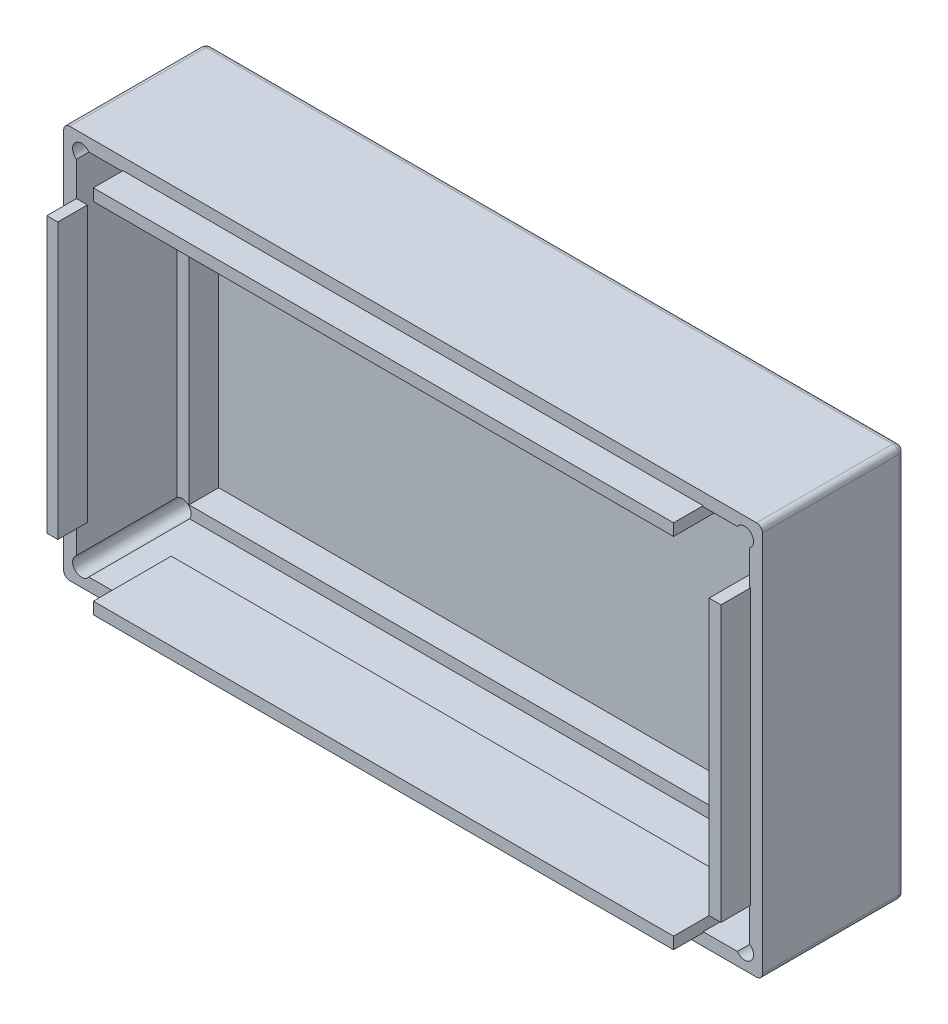
from build123d import *
from build123d.topology import SkipClean

# Parameters (mm, degrees)
BOSS_EXTRUDE1_DEPTH                        = 2
SKETCH2_W                                  = 113.60000000000001
SKETCH2_H                                  = 62.1
SKETCH2_W_2                                = 109.60000000000001
SKETCH2_H_2                                = 58.1
BOSS_EXTRUDE2_DEPTH                        = 5
SKETCH3_R                                  = 1.5000000000000042
CUT_EXTRUDE2_DEPTH                         = 71.85433681838424
MIRROR3_AT_THE_SECOND_PLANE_COPY_1_SKETC_R = 1.5000000000000042
MIRROR3_AT_THE_SECOND_PLANE_COPY_1_DEPTH   = 71.85433681838424
FILLET1_R                                  = 1
FILLET2_R                                  = 1
BOSS_EXTRUDE3_DEPTH                        = 22
SKETCH7_W                                  = 97.9
SKETCH7_H                                  = 1.999999999999993
BOSS_EXTRUDE4_DEPTH                        = 5
CHAMFER1_SIZE                              = 10
CHAMFER2_SIZE                              = 10
CUT_EXTRUDE3_DEPTH                         = 5
FILLET3_R                                  = 1


# Some blends are built 0.0001 mm under size
with BuildPart() as part:
    # Sketch1 → Boss-Extrude1 (new body)
    with BuildSketch(Plane.XY):
        Polygon((-55.697933748362985, 33.2), (62.20206625163701, 33.2), (62.202066251637014, -33.2), (-55.697933748362985, -33.2), align=None)
    extrude(amount=BOSS_EXTRUDE1_DEPTH)

    # Sketch2 → Boss-Extrude2 (add)
    with BuildSketch(Plane.XY.offset(2)):
        with Locations((3.252066251637011, 0)):
            Rectangle(SKETCH2_W, SKETCH2_H)
        with Locations((3.252066251637011, 0)):
            Rectangle(SKETCH2_W_2, SKETCH2_H_2, mode=Mode.SUBTRACT)
    extrude(amount=BOSS_EXTRUDE2_DEPTH)

    # Sketch3 → Cut-Extrude2 (cut, symmetric)
    with BuildSketch(Plane(origin=(0, 0, 0), x_dir=(-1, 0, 0), z_dir=(0, 0, -1))):
        with Locations(Location((-59.202066251637, 30.200000000000003, 0), (0, 0, 34.518107841))):
            Circle(SKETCH3_R)
    cut_extrude2 = extrude(amount=CUT_EXTRUDE2_DEPTH, both=True, mode=Mode.SUBTRACT)

    # Mirror2: Cut-Extrude2 across plane
    add(cut_extrude2.mirror(Plane.ZX), mode=Mode.SUBTRACT)

    # Mirror3: Cut-Extrude2 across plane
    add(cut_extrude2.mirror(Plane.ZX), mode=Mode.SUBTRACT)

    # Mirror3 at the second plane: Cut-Extrude2 across plane
    add(cut_extrude2.mirror(Plane(origin=(3.2520662516370114, 0, 0), x_dir=(0, 0, 1), z_dir=(1, 0, 0))), mode=Mode.SUBTRACT)

    # Mirror3 at the second plane copy 1 sketc → Mirror3 at the second plane copy 1 (cut, symmetric)
    with BuildSketch(Plane(origin=(6.504132503274023, 0, 0), x_dir=(1, 0, 0), z_dir=(0, 0, -1))):
        with Locations(Location((-59.202066251637, 30.200000000000003, 0), (0, 0, 34.518107841))):
            Circle(MIRROR3_AT_THE_SECOND_PLANE_COPY_1_SKETC_R)
    extrude(amount=MIRROR3_AT_THE_SECOND_PLANE_COPY_1_DEPTH, both=True, mode=Mode.SUBTRACT)

    # Fillet1
    fillet1_edges = [part.edges().sort_by_distance(p)[0] for p in [
        (62.202066251637014, -33.2, 1),
        (-55.697933748362985, -33.2, 1),
        (-55.697933748362985, 33.2, 1),
        (62.20206625163701, 33.2, 1),
    ]]
    fillet(fillet1_edges, radius=FILLET1_R)

    # Fillet2
    # the kernel refuses this fillet: 1 mm, written as the material it takes off along each edge
    with BuildSketch(Plane(origin=(62.20206625163701, 32.2, 0), x_dir=(-1, -1.1e-16, 0), z_dir=(1.1e-16, -1, 0)), Plane(origin=(-55.697933748362985, -32.2, 0), x_dir=(1, 0, 0), z_dir=(0, 1, 0))) as fillet2_piece_1:
        with BuildLine():
            CenterArc((FILLET2_R, -FILLET2_R), FILLET2_R, 90, 90)
            Line((0, -FILLET2_R), (0, 0))
            Line((0, 0), (FILLET2_R, 0))
        make_face()
    extrude(amount=64.4, mode=Mode.SUBTRACT)
    with BuildSketch(Plane(origin=(61.202066251637014, -33.2, 0), x_dir=(0, 1, 0), z_dir=(-1, 0, 0))) as fillet2_piece_2:
        with BuildLine():
            CenterArc((FILLET2_R, -FILLET2_R), FILLET2_R, 90, 90)
            Line((0, -FILLET2_R), (0, 0))
            Line((0, 0), (FILLET2_R, 0))
        make_face()
    extrude(amount=115.9, mode=Mode.SUBTRACT)
    with BuildSketch(Plane(origin=(-54.697933748362985, 33.2, 0), x_dir=(0, 0, 1), z_dir=(1, 0, 0))) as fillet2_piece_3:
        with BuildLine():
            CenterArc((FILLET2_R, FILLET2_R), FILLET2_R, 180, 90)
            Line((-1.1e-16, FILLET2_R), (0, 0))
            Line((0, 0), (FILLET2_R, 0))
        make_face()
    extrude(amount=115.89999999999999, mode=Mode.SUBTRACT)
    with BuildSketch(Plane(origin=(-54.697933748362985, -32.2, 0), x_dir=(-1, 0, 0), z_dir=(0, 1, 0))) as fillet2_piece_4:
        with BuildLine():
            CenterArc((1 - FILLET2_R, FILLET2_R), FILLET2_R, 270, 90)
            Line((1, FILLET2_R), (1, 0))
            Line((1, 0), (1 - FILLET2_R, 0))
        make_face()
    revolve(axis=Axis((-54.697933748362985, -32.2, 0), (0, 0, 1)), revolution_arc=90, mode=Mode.SUBTRACT)
    with BuildSketch(Plane(origin=(-54.697933748362985, 32.2, 0), x_dir=(0, 1, 0), z_dir=(1, 0, 0))) as fillet2_piece_5:
        with BuildLine():
            CenterArc((1 - FILLET2_R, FILLET2_R), FILLET2_R, 270, 90)
            Line((1, FILLET2_R), (1, 0))
            Line((1, 0), (1 - FILLET2_R, 0))
        make_face()
    revolve(axis=Axis((-54.697933748362985, 32.2, 0), (0, 0, 1)), revolution_arc=90, mode=Mode.SUBTRACT)
    with BuildSketch(Plane(origin=(61.20206625163701, 32.2, 0), x_dir=(0, 1, 0), z_dir=(-1, 0, 0))) as fillet2_piece_6:
        with BuildLine():
            CenterArc((1 - FILLET2_R, -FILLET2_R), FILLET2_R, 6.36e-15, 90)
            Line((1, -FILLET2_R), (1, 0))
            Line((1, 0), (1 - FILLET2_R, 0))
        make_face()
    revolve(axis=Axis((61.20206625163701, 32.2, 0), (0, 0, -1)), revolution_arc=90, mode=Mode.SUBTRACT)
    with BuildSketch(Plane(origin=(61.202066251637014, -32.2, 0), x_dir=(1, 0, 0), z_dir=(0, 1, 0))) as fillet2_piece_7:
        with BuildLine():
            CenterArc((1 - FILLET2_R, -FILLET2_R), FILLET2_R, 6.36e-15, 90)
            Line((1, -FILLET2_R), (1, 0))
            Line((1, 0), (1 - FILLET2_R, 0))
        make_face()
    revolve(axis=Axis((61.202066251637014, -32.2, 0), (0, 0, -1)), revolution_arc=90, mode=Mode.SUBTRACT)
    with BuildSketch(Plane(origin=(59.202066251637, 30.200000000000003, 0), x_dir=(-0.8239471396211576, 0.5666666666657856, 0), z_dir=(-0.5666666666657856, -0.8239471396211576, 0))) as fillet2_piece_8:
        with BuildLine():
            CenterArc((1.5000000000000024 + FILLET2_R, -FILLET2_R), FILLET2_R, 90, 90)
            Line((1.5000000000000024, -FILLET2_R), (1.5000000000000024, 0))
            Line((1.5000000000000024, 0), (1.5000000000000024 + FILLET2_R, 0))
        make_face()
    revolve(axis=Axis((59.202066251637, 30.200000000000003, 0), (0, 0, -1)), mode=Mode.SUBTRACT)
    with BuildSketch(Plane(origin=(59.202066251637, -30.200000000000003, 0), x_dir=(-0.8239471396211576, -0.5666666666657856, 0), z_dir=(0.5666666666657856, -0.8239471396211576, 0))) as fillet2_piece_9:
        with BuildLine():
            CenterArc((1.5000000000000024 + FILLET2_R, -FILLET2_R), FILLET2_R, 90, 90)
            Line((1.5000000000000024, -FILLET2_R), (1.5000000000000024, 0))
            Line((1.5000000000000024, 0), (1.5000000000000024 + FILLET2_R, 0))
        make_face()
    revolve(axis=Axis((59.202066251637, -30.200000000000003, 0), (0, 0, -1)), mode=Mode.SUBTRACT)
    with BuildSketch(Plane(origin=(-52.69793374836298, 30.200000000000003, 0), x_dir=(0.8239471396211576, 0.5666666666657856, 0), z_dir=(-0.5666666666657856, 0.8239471396211576, 0))) as fillet2_piece_10:
        with BuildLine():
            CenterArc((1.5000000000000024 + FILLET2_R, -FILLET2_R), FILLET2_R, 90, 90)
            Line((1.5000000000000062, -FILLET2_R), (1.5000000000000024, 0))
            Line((1.5000000000000024, 0), (1.5000000000000024 + FILLET2_R, 0))
        make_face()
    revolve(axis=Axis((-52.69793374836298, 30.200000000000003, 0), (0, 0, -1)), mode=Mode.SUBTRACT)
    with BuildSketch(Plane(origin=(-52.69793374836298, -30.200000000000003, 0), x_dir=(0.8239471396211576, -0.5666666666657856, 0), z_dir=(0.5666666666657856, 0.8239471396211576, 0))) as fillet2_piece_11:
        with BuildLine():
            CenterArc((1.5000000000000024 + FILLET2_R, -FILLET2_R), FILLET2_R, 90, 90)
            Line((1.5000000000000062, -FILLET2_R), (1.5000000000000024, 0))
            Line((1.5000000000000024, 0), (1.5000000000000024 + FILLET2_R, 0))
        make_face()
    revolve(axis=Axis((-52.69793374836298, -30.200000000000003, 0), (0, 0, -1)), mode=Mode.SUBTRACT)

    # Sketch5 → Boss-Extrude3 (add)
    with SkipClean():  # the faces are left unmerged after this step: merging them gives an invalid solid
        with BuildSketch(Plane.XY.offset(2)):
            with BuildLine():
                Line((-54.697933748362985, -33.2), (61.202066251637014, -33.2))
                ThreePointArc((61.202066251637014, -33.2), (61.90917303282356, -32.90710678118655), (62.202066251637014, -32.2))
                Line((62.202066251637014, -32.2), (62.20206625163701, 32.2))
                ThreePointArc((62.20206625163701, 32.2), (61.90917303282355, 32.907106781186556), (61.202066251637, 33.2))
                Line((61.202066251637, 33.2), (-54.697933748362985, 33.2))
                ThreePointArc((-54.697933748362985, 33.2), (-55.40504052954953, 32.90710678118655), (-55.697933748362985, 32.2))
                Line((-55.697933748362985, 32.2), (-55.697933748362985, -32.199999999999974))
                ThreePointArc((-55.697933748362985, -32.199999999999974), (-55.405040529549545, -32.90710678118654), (-54.697933748362985, -33.2))
            make_face()
            with BuildLine():
                Line((-51.46201303893214, -31.05), (57.966145542206164, -31.05))
                ThreePointArc((57.966145542206164, -31.05), (60.262726423416815, -31.260660171779836), (60.052066251637015, -28.96407929056918))
                Line((60.052066251637015, -28.96407929056918), (60.052066251637015, 28.96407929056918))
                ThreePointArc((60.052066251637015, 28.96407929056918), (60.262726423416815, 31.260660171779836), (57.966145542206164, 31.05))
                Line((57.966145542206164, 31.05), (-51.46201303893214, 31.05))
                ThreePointArc((-51.46201303893214, 31.05), (-53.7585939201428, 31.260660171779833), (-53.547933748362986, 28.964079290569178))
                Line((-53.547933748362986, 28.964079290569178), (-53.547933748362986, -28.964079290569178))
                ThreePointArc((-53.547933748362986, -28.964079290569178), (-53.75859392014279, -31.260660171779833), (-51.46201303893214, -31.05))
            make_face(mode=Mode.SUBTRACT)
        extrude(amount=BOSS_EXTRUDE3_DEPTH)

    # Sketch7 → Boss-Extrude4 (add)
    with SkipClean():  # the faces are left unmerged after this step: merging them gives an invalid solid
        with BuildSketch(Plane.XY.offset(24)):
            Polygon((-51.69793374836299, 23.2), (-53.547933748362986, 23.2), (-53.547933748362986, -23.2), (-51.69793374836299, -23.199999999999992), align=None)
            with Locations((3.252066251637011, 30.2)):
                Rectangle(SKETCH7_W, SKETCH7_H)
            Polygon((-45.69793374836298, -29.199999999999996), (52.20206625163701, -29.200000000000003), (52.20206625163701, -31.200000000000003), (-45.69793374836298, -31.200000000000006), align=None)
            Polygon((58.202066251637014, 23.2), (58.202066251637014, -23.200000000000006), (60.202066251637, -23.200000000000006), (60.202066251637014, 23.2), align=None)
        extrude(amount=BOSS_EXTRUDE4_DEPTH)


with BuildPart() as boss_extrude4_piece_1:
    # of the separate pieces the step leaves, piece 1, a body of its own (boss_extrude4_pieces)
    add(part.part.solids().sort_by_distance((61.202066252, 33.2, 1))[0])

    # Chamfer1
    # the kernel refuses this chamfer: 10 mm, written as the material it adds along each edge
    with BuildSketch(Plane(origin=(-45.69793374836298, -31.05, 24), x_dir=(0, -0.027495876610586317, -0.9996219169112968), z_dir=(1, 0, 0))) as chamfer1_piece_1_section:
        Polygon((CHAMFER1_SIZE * 0.999621916911, CHAMFER1_SIZE * 0.0274958766106), (-CHAMFER1_SIZE * 0.0274958766106, CHAMFER1_SIZE * 0.999621916911), (0, 0), align=None)
    chamfer1_piece_1 = extrude(amount=97.89999999999998, mode=Mode.PRIVATE)
    chamfer1_piece_1 = split(chamfer1_piece_1, bisect_by=Plane(origin=(3.2520662516369896, -29.2, 19.44678604224059), z_dir=(-7e-17, -1, 0)), keep=Keep.TOP, mode=Mode.PRIVATE)
    add(chamfer1_piece_1)
    with BuildSketch(Plane(origin=(52.20206625163702, 31.05, 24), x_dir=(0, 0.027495876610586317, -0.9996219169112968), z_dir=(-1, 0, 0))) as chamfer1_piece_2_section:
        Polygon((CHAMFER1_SIZE * 0.999621916911, CHAMFER1_SIZE * 0.0274958766106), (-CHAMFER1_SIZE * 0.0274958766106, CHAMFER1_SIZE * 0.999621916911), (0, 0), align=None)
    chamfer1_piece_2 = extrude(amount=97.90000000000002, mode=Mode.PRIVATE)
    chamfer1_piece_2 = split(chamfer1_piece_2, bisect_by=Plane(origin=(3.252066251637011, 29.200000000000003, 19.446786042240586), z_dir=(0, 1, 0)), keep=Keep.TOP, mode=Mode.PRIVATE)
    add(chamfer1_piece_2)

    # Chamfer2
    # the kernel refuses this chamfer: 10 mm, written as the material it adds along each edge
    with BuildSketch(Plane(origin=(60.052066251637015, -23.200000000000006, 24), x_dir=(0.027495876610586317, 0, -0.9996219169112968), z_dir=(0, 1, 0))) as chamfer2_piece_1_section:
        Polygon((CHAMFER2_SIZE * 0.999621916911, CHAMFER2_SIZE * 0.0274958766106), (-CHAMFER2_SIZE * 0.0274958766106, CHAMFER2_SIZE * 0.999621916911), (0, 0), align=None)
    chamfer2_piece_1 = extrude(amount=46.400000000000006, mode=Mode.PRIVATE)
    chamfer2_piece_1 = split(chamfer2_piece_1, bisect_by=Plane(origin=(58.202066251637014, 0, 19.446786042240586), z_dir=(1, 0, 0)), keep=Keep.TOP, mode=Mode.PRIVATE)
    add(chamfer2_piece_1)

    # Sketch8 → Cut-Extrude3 (cut)
    with BuildSketch(Plane.XY.offset(2)):
        Polygon((-0.69793374836298, 26.200000000000003), (11.302066251637006, 26.200000000000003), (11.302066251637001, 15.199999999999998), (-0.6979337483629935, 15.200000000000001), align=None)
    extrude(amount=-CUT_EXTRUDE3_DEPTH, mode=Mode.SUBTRACT)

    # Fillet3
    fillet3_edges = [boss_extrude4_piece_1.edges().sort_by_distance(p)[0] for p in [
        (-0.6979337483629867, 20.700000000000003, 0),
        (5.302066251637012, 26.200000000000003, 0),
        (-0.69793374836298, 26.200000000000003, 1),
        (11.302066251637005, 20.7, 0),
        (11.302066251637006, 26.200000000000003, 1),
        (5.302066251637004, 15.2, 0),
        (-0.6979337483629868, 20.700000000000003, 2),
        (11.302066251637005, 20.7, 2),
        (5.3020662516370125, 26.200000000000003, 2),
    ]]
    fillet(fillet3_edges, radius=FILLET3_R - 0.0001)  # a hair under: the kernel refuses the full size


with BuildPart() as boss_extrude4_piece_2:
    # of the separate pieces the step leaves, piece 2, a body of its own (boss_extrude4_pieces)
    add(part.part.solids().sort_by_distance((-51.697933748, 23.2, 24))[0])


solid = Compound([boss_extrude4_piece_1.part, boss_extrude4_piece_2.part])
